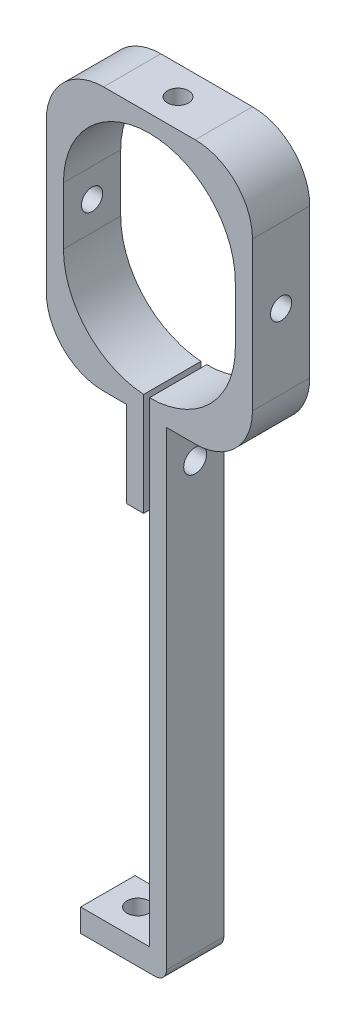
from build123d import *

# Parameters (mm, degrees)
BOSS_EXTRUDE2_DEPTH      = 10
CUT_EXTRUDE2_DEPTH       = 90.877694674
CUT_EXTRUDE2_DEPTH_BACK  = 90.877694674
SKETCH5_W                = 11
SKETCH5_H                = 67.407766248
CUT_EXTRUDE3_DEPTH       = 87.446515257
CUT_EXTRUDE3_DEPTH_BACK  = 87.446515257
SKETCH16_R               = 1.85
FILLET16_R               = 15
CUT_EXTRUDE20_DEPTH      = 92.021975369
CUT_EXTRUDE20_DEPTH_BACK = 92.021975369
SKETCH45_R               = 1.85
SKETCH52_W               = 15
SKETCH52_H               = 10
BOSS_EXTRUDE25_DEPTH     = 4
FILLET17_R               = 10
FILLET18_R               = 2
SKETCH53_R               = 1.9
CUT_EXTRUDE25_DEPTH      = 10
SKETCH55_W               = 0.5
SKETCH55_H               = 4
CUT_EXTRUDE28_DEPTH      = 10
CUT_EXTRUDE32_DEPTH      = 91.055538419
CUT_EXTRUDE32_DEPTH_BACK = 91.055538419
SKETCH60_R               = 2
FILLET19_R               = 10
SKETCH61_R               = 1.85
CUT_EXTRUDE33_DEPTH      = 10


with BuildPart() as part:
    # Sketch2 → Boss-Extrude2 (new body)
    with BuildSketch(Plane.XY):
        Polygon((18, -3), (33, -3), (33, 43), (-3, 43), (-3, -3), (11, -3), (11, -83), (18, -83), align=None)
        Polygon((15, 0), (30, 0), (30, 40), (0, 40), (0, 0), (14, 0), (14, -80), (15, -80), align=None, mode=Mode.SUBTRACT)
    extrude(amount=BOSS_EXTRUDE2_DEPTH)

    # Sketch5 → Cut-Extrude2 (cut, two sides: drawn at the far end of the back side and taken through both)
    with BuildSketch(Plane.XY.offset(10).offset(-CUT_EXTRUDE2_DEPTH_BACK)):
        with Locations((9.5, -51.703883124)):
            Rectangle(SKETCH5_W, SKETCH5_H)
    extrude(amount=CUT_EXTRUDE2_DEPTH + CUT_EXTRUDE2_DEPTH_BACK, mode=Mode.SUBTRACT)

    # Sketch16 → Cut-Extrude3 (cut, two sides: drawn at the far end of the back side and taken through both)
    with BuildSketch(Plane.ZY.offset(-11).offset(-CUT_EXTRUDE3_DEPTH_BACK)):
        with Locations((5, -10.5)):
            Circle(SKETCH16_R)
    extrude(amount=CUT_EXTRUDE3_DEPTH + CUT_EXTRUDE3_DEPTH_BACK, mode=Mode.SUBTRACT)

    # Fillet16
    # the kernel refuses this fillet: 15 mm, written as the material it adds along each edge
    with BuildSketch(Plane(origin=(0, 40, 0), x_dir=(0, -1, 0), z_dir=(0, 0, 1)), Plane(origin=(30, 40, 0), x_dir=(-1, 0, 0), z_dir=(0, 0, 1)), Plane(origin=(30, 0, 0), x_dir=(0, 1, 0), z_dir=(0, 0, 1))) as fillet16_piece_1:
        with BuildLine():
            CenterArc((FILLET16_R, FILLET16_R), FILLET16_R, 180, 90)
            Line((0, FILLET16_R), (-FILLET16_R * 0.02, FILLET16_R))
            Line((-FILLET16_R * 0.02, FILLET16_R), (-FILLET16_R * 0.02, -FILLET16_R * 0.02))
            Line((-FILLET16_R * 0.02, -FILLET16_R * 0.02), (FILLET16_R, -FILLET16_R * 0.02))
            Line((FILLET16_R, -FILLET16_R * 0.02), (FILLET16_R, 0))
        make_face()
    extrude(amount=10)
    with BuildSketch(Plane(origin=(0, 0, 0), x_dir=(1, 0, 0), z_dir=(0, 0, 1))) as fillet16_piece_2:
        with BuildLine():
            CenterArc((15, 14.966629547), FILLET16_R, 180, 86.177446271)
            Line((0, 14.966629547), (-0.3, 14.966629547))
            Line((-0.3, 14.966629547), (-0.3, 0))
            Line((-0.3, 0), (0, -0.3))
            ThreePointArc((0, -0.3), (7, -0.3), (13.98, -0.299332591))
            Line((13.98, -0.299332591), (14, 0))
        make_face()
    extrude(amount=10)

    # Sketch45 → Cut-Extrude20 (cut, two sides: drawn at the far end of the back side and taken through both)
    with BuildSketch(Plane.ZY.offset(3).offset(-CUT_EXTRUDE20_DEPTH_BACK)):
        with Locations((5, 20)):
            Circle(SKETCH45_R)
    extrude(amount=CUT_EXTRUDE20_DEPTH + CUT_EXTRUDE20_DEPTH_BACK, mode=Mode.SUBTRACT)

    # Sketch52 → Boss-Extrude25 (add)
    with BuildSketch(Plane.XZ.offset(83)):
        with Locations((10.5, 5)):
            Rectangle(SKETCH52_W, SKETCH52_H)
    extrude(amount=BOSS_EXTRUDE25_DEPTH)

    # Fillet17
    fillet17_edges = [part.edges().sort_by_distance(p)[0] for p in [
        (-3, -3, 5),
        (33, -3, 5),
    ]]
    fillet(fillet17_edges, radius=FILLET17_R)

    # Fillet18
    fillet18_edges = [part.edges().sort_by_distance(p)[0] for p in [
        (18, -87, 5),
    ]]
    fillet(fillet18_edges, radius=FILLET18_R)

    # Sketch53 → Cut-Extrude25 (cut)
    with BuildSketch(Plane.XZ.offset(87)):
        with Locations(Location((8, 5, 0), (0, 0, 270))):
            Circle(SKETCH53_R)
    extrude(amount=-CUT_EXTRUDE25_DEPTH, mode=Mode.SUBTRACT)

    # Sketch55 → Cut-Extrude28 (cut)
    with BuildSketch(Plane.ZY.offset(-3)):
        with Locations((0.25, -85)):
            Rectangle(SKETCH55_W, SKETCH55_H)
    extrude(amount=-CUT_EXTRUDE28_DEPTH, mode=Mode.SUBTRACT)

    # Sketch60 → Cut-Extrude32 (cut, two sides: drawn at the far end of the back side and taken through both)
    with BuildSketch(Plane(origin=(18, 0, 0), x_dir=(0, 0, -1), z_dir=(1, 0, 0)).offset(-CUT_EXTRUDE32_DEPTH_BACK)):
        with Locations((-5, -10.5)):
            Circle(SKETCH60_R)
    extrude(amount=CUT_EXTRUDE32_DEPTH + CUT_EXTRUDE32_DEPTH_BACK, mode=Mode.SUBTRACT)

    # Fillet19
    fillet19_edges = [part.edges().sort_by_distance(p)[0] for p in [
        (-3, 43, 5),
        (33, 43, 5),
    ]]
    fillet(fillet19_edges, radius=FILLET19_R)

    # Sketch61 → Cut-Extrude33 (cut)
    with BuildSketch(Plane(origin=(0, 43, 0), x_dir=(1, 0, 0), z_dir=(0, 1, 0))):
        with Locations(Location((15, -5, 0), (0, 0, 270))):
            Circle(SKETCH61_R)
    extrude(amount=-CUT_EXTRUDE33_DEPTH, mode=Mode.SUBTRACT)


solid = part.part
